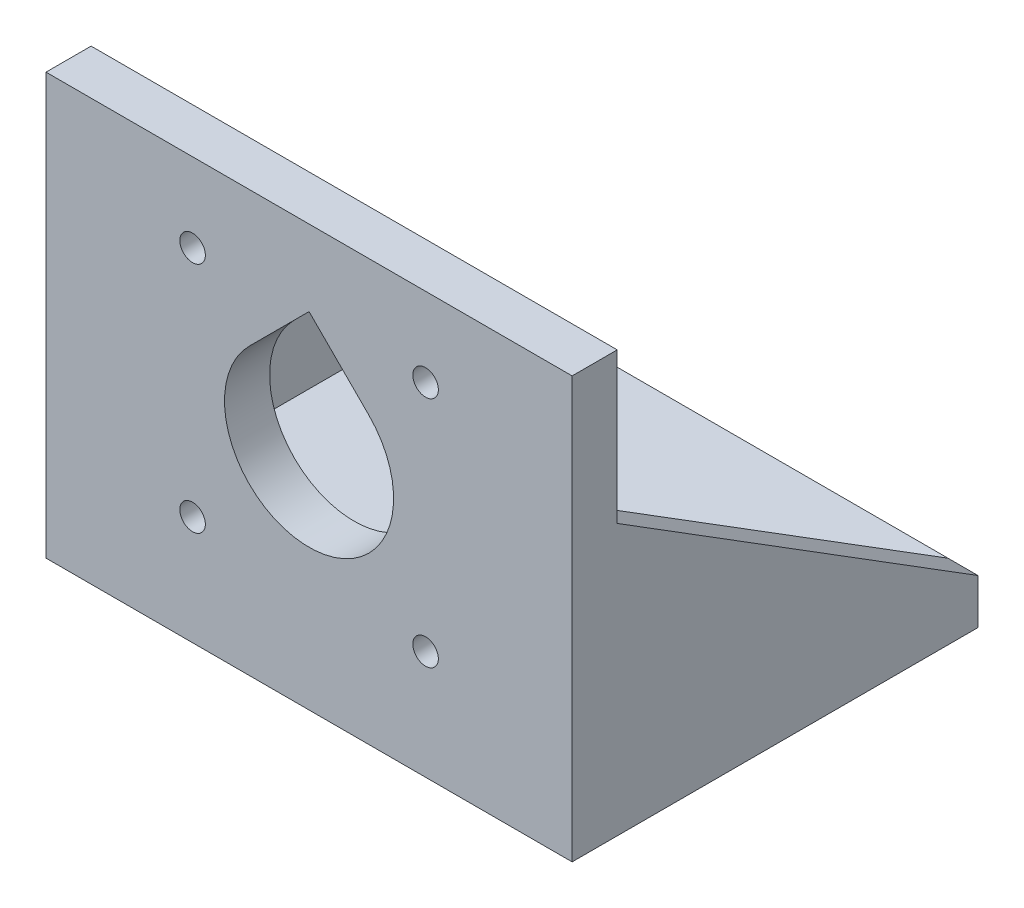
from build123d import *

# Parameters (mm, degrees)
SKETCH_01_W                   = 70
SKETCH_01_H                   = 56
EXTRUDE_01_DEPTH              = 6
SKETCH_02_W                   = 70
SKETCH_02_H                   = 54
EXTRUDE_02_DEPTH              = 6
EXTRUDE_03_DEPTH              = 4
EXTRUDE_START                 = 66
EXTRUDE_04_DEPTH              = 4
CUT_EXTRUDE_05_4_3_DEPTH      = 102.685790551
CUT_EXTRUDE_05_4_3_DEPTH_BACK = 102.685790551
SKETCH_05_R                   = 11.25
SKETCH_05_R_2                 = 1.7
CUT_EXTRUDE_06_DEPTH          = 102.685790551
CUT_EXTRUDE_06_DEPTH_BACK     = 102.685790551
CUT_EXTRUDE_07_4_4_DEPTH      = 102.685790551
CUT_EXTRUDE_07_4_4_DEPTH_BACK = 102.685790551
SKETCH_07_R                   = 2.25


with BuildPart() as part:
    # 01_Пластина_эскиз → 01_Передняя_пластина (new body)
    with BuildSketch(Plane.XY):
        with Locations((35, 28)):
            Rectangle(SKETCH_01_W, SKETCH_01_H)
    extrude(amount=EXTRUDE_01_DEPTH)

    # 02_Полка_эскиз → 02_Полка (add)
    with BuildSketch(Plane(origin=(0, 0, 0), x_dir=(1, 0, 0), z_dir=(0, 1, 0))):
        with Locations((35, 21)):
            Rectangle(SKETCH_02_W, SKETCH_02_H)
    extrude(amount=EXTRUDE_02_DEPTH)

    # 03_Косынка_левая_эскиз → 03_Косынка_левая (add)
    with BuildSketch(Plane(origin=(0, 0, 0), x_dir=(0, 0, -1), z_dir=(1, 0, 0))):
        Polygon((48, 6), (0, 6), (0, 36), align=None)
    extrude(amount=EXTRUDE_03_DEPTH)

    # 04_Косынка_правая_эскиз → 04_Косынка_правая (add)
    with BuildSketch(Plane(origin=(0, 0, 0), x_dir=(0, 0, -1), z_dir=(1, 0, 0)).offset(EXTRUDE_START)):
        Polygon((48, 6), (0, 6), (0, 36), align=None)
    extrude(amount=EXTRUDE_04_DEPTH)

    # 05_Мотор_передний_фланец_эскиз → 05_Буртик_и_4_отверстия_М3 (cut, two sides: drawn at the far end of the back side and taken through both)
    with BuildSketch(Plane.XY.offset(-CUT_EXTRUDE_05_4_3_DEPTH_BACK)):
        with Locations((35, 30)):
            Circle(SKETCH_05_R)
        with Locations((19.5, 14.5)):
            Circle(SKETCH_05_R_2)
        with Locations((19.5, 45.5)):
            Circle(SKETCH_05_R_2)
        with Locations((50.5, 14.5)):
            Circle(SKETCH_05_R_2)
        with Locations((50.5, 45.5)):
            Circle(SKETCH_05_R_2)
    extrude(amount=CUT_EXTRUDE_05_4_3_DEPTH + CUT_EXTRUDE_05_4_3_DEPTH_BACK, mode=Mode.SUBTRACT)

    # 06_Свод_45град_эскиз → 06_Свод_отверстия_для_печати (cut, two sides: drawn at the far end of the back side and taken through both)
    with BuildSketch(Plane.XY.offset(-CUT_EXTRUDE_06_DEPTH_BACK)):
        Polygon((27.045048712, 37.954951288), (42.954951288, 37.954951288), (35, 45.909902577), align=None)
    extrude(amount=CUT_EXTRUDE_06_DEPTH + CUT_EXTRUDE_06_DEPTH_BACK, mode=Mode.SUBTRACT)

    # 07_Крепление_полки_эскиз → 07_4_отверстия_М4 (cut, two sides: drawn at the far end of the back side and taken through both)
    with BuildSketch(Plane(origin=(0, 0, 0), x_dir=(1, 0, 0), z_dir=(0, 1, 0)).offset(-CUT_EXTRUDE_07_4_4_DEPTH_BACK)):
        with Locations((8.5, 12)):
            Circle(SKETCH_07_R)
        with Locations((8.5, 38)):
            Circle(SKETCH_07_R)
        with Locations((61.5, 12)):
            Circle(SKETCH_07_R)
        with Locations((61.5, 38)):
            Circle(SKETCH_07_R)
    extrude(amount=CUT_EXTRUDE_07_4_4_DEPTH + CUT_EXTRUDE_07_4_4_DEPTH_BACK, mode=Mode.SUBTRACT)


solid = part.part
